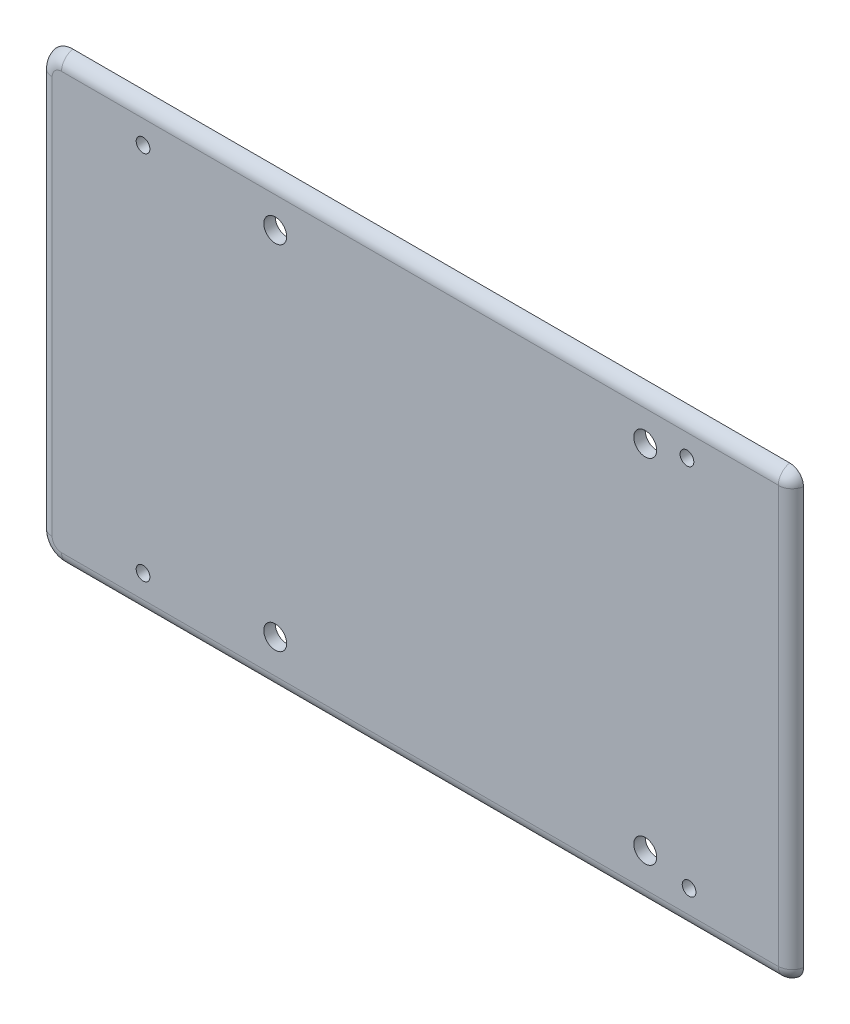
from build123d import *

# Parameters (mm, degrees)
CROQUIS1_R              = 1.5
SALIENTE_EXTRUIR2_DEPTH = 2.5
CROQUIS2_R              = 2.5
CORTAR_EXTRUIR1_DEPTH   = 2.5
REDONDEO1_R             = 3


with BuildPart() as part:
    # Croquis1 → Saliente-Extruir2 (new body)
    with BuildSketch(Plane.XY):
        with BuildLine():
            Line((-71.814275766, 92), (-71.814275766, 5))
            ThreePointArc((-71.814275766, 5), (-70.349809672, 1.464466094), (-66.814275766, 0))
            Line((-66.814275766, 0), (89.815390375, 0))
            ThreePointArc((89.815390375, 0), (91.936710719, 0.878679656), (92.815390375, 3))
            Line((92.815390375, 3), (92.815390375, 94))
            ThreePointArc((92.815390375, 94), (91.936710719, 96.121320344), (89.815390375, 97))
            Line((89.815390375, 97), (-66.814275766, 97))
            ThreePointArc((-66.814275766, 97), (-70.349809672, 95.535533906), (-71.814275766, 92))
        make_face()
        with Locations((69.850202166, 89.208902584)):
            Circle(CROQUIS1_R, mode=Mode.SUBTRACT)
        with Locations((-49, 89)):
            Circle(CROQUIS1_R, mode=Mode.SUBTRACT)
        with Locations((-49, 8)):
            Circle(CROQUIS1_R, mode=Mode.SUBTRACT)
        with Locations((70.315390375, 8)):
            Circle(CROQUIS1_R, mode=Mode.SUBTRACT)
    extrude(amount=SALIENTE_EXTRUIR2_DEPTH)

    # Croquis2 → Cortar-Extruir1 (cut)
    with BuildSketch(Plane.XY.offset(2.5)):
        with Locations((60.731545651, 10.35024669)):
            Circle(CROQUIS2_R)
        with Locations((60.731545651, 87.35024669)):
            Circle(CROQUIS2_R)
        with Locations((-20.117590151, 10.35024669)):
            Circle(CROQUIS2_R)
        with Locations((-20.117590151, 87.35024669)):
            Circle(CROQUIS2_R)
    extrude(amount=-CORTAR_EXTRUIR1_DEPTH, mode=Mode.SUBTRACT)

    # Redondeo1
    # the kernel refuses this fillet: 3 mm, written as the material it takes off along each edge
    with BuildSketch(Plane(origin=(89.815390375, 3, 2.5), x_dir=(0, -1, 0), z_dir=(-1, 0, 0))) as redondeo1_piece_1:
        with BuildLine():
            CenterArc((0.041960108, -3), REDONDEO1_R, 9.594068227, 80.405931773)
            Line((3, -2.5), (3.059160798, -2.49))
            ThreePointArc((3.059160798, -2.49), (3.06, -1.25), (3.06, 0))
            Line((3.06, 0), (3, 0.06))
            Line((3, 0.06), (0.041960108, 0.06))
            Line((0.041960108, 0.06), (0.041960108, 0))
        make_face()
    revolve(axis=Axis((89.815390375, 3, 2.5), (0, 0, 1)), revolution_arc=90, mode=Mode.SUBTRACT)
    with BuildSketch(Plane(origin=(-66.814275766, 0, 2.5), x_dir=(0, 1, 0), z_dir=(1, 0, 0)), Plane(origin=(89.815390375, 97, 2.5), x_dir=(0, -1, 0), z_dir=(-1, 0, 0))) as redondeo1_piece_2:
        with BuildLine():
            CenterArc((2.958039892, -3), REDONDEO1_R, 90, 80.405931773)
            Line((0, -2.5), (-0.059160798, -2.49))
            ThreePointArc((-0.059160798, -2.49), (-0.06, -1.25), (-0.06, 0))
            Line((-0.06, 0), (0, 0.06))
            Line((0, 0.06), (2.958039892, 0.06))
            Line((2.958039892, 0.06), (2.958039892, 0))
        make_face()
    extrude(amount=156.629666142, mode=Mode.SUBTRACT)
    with BuildSketch(Plane(origin=(-66.814275766, 5, 2.5), x_dir=(-1, 0, 0), z_dir=(0, 1, 0))) as redondeo1_piece_3:
        with BuildLine():
            CenterArc((2.041960108, -3), REDONDEO1_R, 9.594068227, 80.405931773)
            Line((2.041960108, 0), (2.041960108, 0.06))
            Line((2.041960108, 0.06), (5, 0.06))
            Line((5, 0.06), (5.06, 0))
            ThreePointArc((5.06, 0), (5.06, -1.25), (5.059160798, -2.49))
            Line((5.059160798, -2.49), (5, -2.5))
        make_face()
    revolve(axis=Axis((-66.814275766, 5, 2.5), (0, 0, 1)), revolution_arc=90, mode=Mode.SUBTRACT)
    with BuildSketch(Plane(origin=(-71.814275766, 92, 2.5), x_dir=(0, 0, -1), z_dir=(0, -1, 0))) as redondeo1_piece_4:
        with BuildLine():
            CenterArc((3, 2.958039892), REDONDEO1_R, 180, 80.405931773)
            Line((0, 2.958039892), (-0.06, 2.958039892))
            Line((-0.06, 2.958039892), (-0.06, 0))
            Line((-0.06, 0), (0, -0.06))
            ThreePointArc((0, -0.06), (1.25, -0.06), (2.49, -0.059160798))
            Line((2.49, -0.059160798), (2.5, 0))
        make_face()
    extrude(amount=87, mode=Mode.SUBTRACT)
    with BuildSketch(Plane(origin=(-66.814275766, 92, 2.5), x_dir=(0, 1, 0), z_dir=(1, 0, 0))) as redondeo1_piece_5:
        with BuildLine():
            CenterArc((2.041960108, -3), REDONDEO1_R, 9.594068227, 80.405931773)
            Line((2.041960108, 0), (2.041960108, 0.06))
            Line((2.041960108, 0.06), (5, 0.06))
            Line((5, 0.06), (5.06, 0))
            ThreePointArc((5.06, 0), (5.06, -1.25), (5.059160798, -2.49))
            Line((5.059160798, -2.49), (5, -2.5))
        make_face()
    revolve(axis=Axis((-66.814275766, 92, 2.5), (0, 0, 1)), revolution_arc=90, mode=Mode.SUBTRACT)
    with BuildSketch(Plane(origin=(89.815390375, 94, 2.5), x_dir=(1, 0, 0), z_dir=(0, -1, 0))) as redondeo1_piece_6:
        with BuildLine():
            CenterArc((0.041960108, -3), REDONDEO1_R, 9.594068227, 80.405931773)
            Line((3, -2.5), (3.059160798, -2.49))
            ThreePointArc((3.059160798, -2.49), (3.06, -1.25), (3.06, 0))
            Line((3.06, 0), (3, 0.06))
            Line((3, 0.06), (0.041960108, 0.06))
            Line((0.041960108, 0.06), (0.041960108, 0))
        make_face()
    revolve(axis=Axis((89.815390375, 94, 2.5), (0, 0, 1)), revolution_arc=90, mode=Mode.SUBTRACT)
    with BuildSketch(Plane(origin=(92.815390375, 3, 2.5), x_dir=(-1, 0, 0), z_dir=(0, 1, 0))) as redondeo1_piece_7:
        with BuildLine():
            CenterArc((2.958039892, -3), REDONDEO1_R, 90, 80.405931773)
            Line((0, -2.5), (-0.059160798, -2.49))
            ThreePointArc((-0.059160798, -2.49), (-0.06, -1.25), (-0.06, 0))
            Line((-0.06, 0), (0, 0.06))
            Line((0, 0.06), (2.958039892, 0.06))
            Line((2.958039892, 0.06), (2.958039892, 0))
        make_face()
    extrude(amount=91, mode=Mode.SUBTRACT)


solid = part.part
